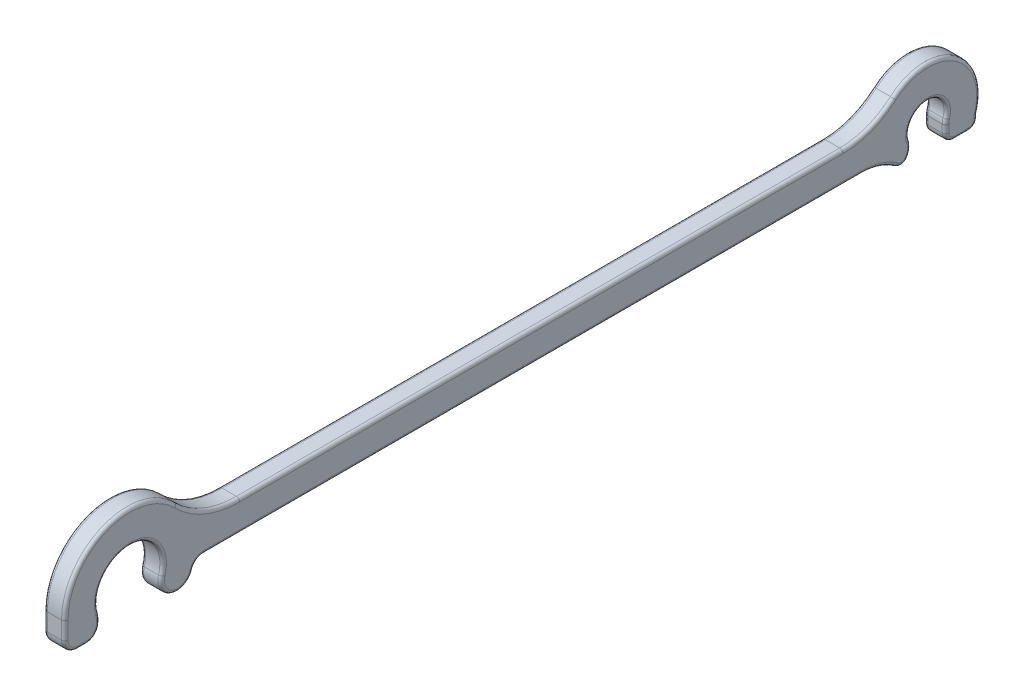
from build123d import *

# Parameters (mm, degrees)
BASE_FLANGE1_DEPTH = 0.95
FILLET1_R          = 0.15


# Sheet-metal steps are written as plain solids
with BuildPart() as part:
    # Sketch1 → Base-Flange1 (new body)
    with BuildSketch(Plane(origin=(0, 0, 0), x_dir=(0, 0, -1), z_dir=(1, 0, 0))):
        with BuildLine():
            Line((4.9989999, 0.9), (32.606977395, 0.9))
            ThreePointArc((32.606977395, 0.9), (33.847044312, 1.127045059), (34.926224905, 1.778723404))
            ThreePointArc((34.926224905, 1.778723404), (37.80078387, 1.987105011), (38.759779045, -0.730769231))
            Line((38.759779045, -0.730769231), (38.759779045, -0.85))
            ThreePointArc((38.759779045, -0.85), (38.642621757, -1.132842712), (38.359779045, -1.25))
            Line((38.359779045, -1.25), (37.69616461, -1.25))
            ThreePointArc((37.69616461, -1.25), (37.413321897, -1.132842712), (37.29616461, -0.85))
            Line((37.29616461, -0.85), (37.29616461, -0.5))
            ThreePointArc((37.29616461, -0.5), (37.305316843, -0.383189954), (37.332550174, -0.269230769))
            ThreePointArc((37.332550174, -0.269230769), (36.5, 0.875), (35.667449826, -0.269230769))
            ThreePointArc((35.667449826, -0.269230769), (35.697994411, -0.593420295), (35.588264267, -0.9))
            ThreePointArc((35.588264267, -0.9), (35.344065569, -1.067822922), (35.054280366, -1.006))
            ThreePointArc((35.054280366, -1.006), (34.298753938, -0.629551565), (33.464637639, -0.5))
            Line((33.464637639, -0.5), (3.365728004, -0.5))
            ThreePointArc((3.365728004, -0.5), (3.058268658, -0.601695186), (2.872087897, -0.866666667))
            ThreePointArc((2.872087897, -0.866666667), (1.937399256, -1.368021974), (1.436043949, -0.433333333))
            ThreePointArc((1.436043949, -0.433333333), (0, 1.5), (-1.436043949, -0.433333333))
            ThreePointArc((-1.436043949, -0.433333333), (-1.412103498, -0.540493107), (-1.404065923, -0.65))
            Line((-1.404065923, -0.65), (-1.404065923, -0.8))
            ThreePointArc((-1.404065923, -0.8), (-1.579801854, -1.224264069), (-2.004065923, -1.4))
            Line((-2.004065923, -1.4), (-2.4, -1.4))
            ThreePointArc((-2.4, -1.4), (-2.824264069, -1.224264069), (-3, -0.8))
            Line((-3, -0.8), (-3, 0))
            ThreePointArc((-3, 0), (-1.134176885, 2.777344558), (2.142428529, 2.1))
            ThreePointArc((2.142428529, 2.1), (3.449806561, 1.212182217), (4.9989999, 0.9))
        make_face()
    extrude(amount=-BASE_FLANGE1_DEPTH)

    # Fillet1
    fillet1_edges = [part.edges().sort_by_distance(p)[0] for p in [
        (-0.95, 1.987105011, -37.80078387),
        (-0.95, 1.127045059, -33.847044312),
        (-0.95, -0.790384615, -38.759779045),
        (-0.95, -1.132842712, -38.642621757),
        (-0.95, -1.25, -38.027971827),
        (-0.95, -1.132842712, -37.413321897),
        (-0.95, -0.675, -37.29616461),
        (-0.95, -0.383189954, -37.305316843),
        (-0.95, 0.875, -36.5),
        (-0.95, -0.593420295, -35.697994411),
        (-0.95, -1.067822922, -35.344065569),
        (-0.95, -0.629551565, -34.298753938),
        (-0.95, -0.5, -18.415182822),
        (-0.95, -0.601695186, -3.058268658),
        (-0.95, -1.368021974, -1.937399256),
        (-0.95, 1.5, 0),
        (-0.95, -0.540493107, 1.412103498),
        (-0.95, -0.725, 1.404065923),
        (-0.95, -1.224264069, 1.579801854),
        (-0.95, -1.4, 2.202032961),
        (-0.95, -1.224264069, 2.824264069),
        (-0.95, -0.4, 3),
        (-0.95, 2.777344558, 1.134176885),
        (-0.95, 1.212182217, -3.449806561),
        (0, 1.987105011, -37.80078387),
        (0, 1.127045059, -33.847044312),
        (0, -0.790384615, -38.759779045),
        (0, -1.132842712, -38.642621757),
        (0, -1.25, -38.027971827),
        (0, -1.132842712, -37.413321897),
        (0, -0.675, -37.29616461),
        (0, -0.383189954, -37.305316843),
        (0, 0.875, -36.5),
        (0, -0.593420295, -35.697994411),
        (0, -1.067822922, -35.344065569),
        (0, -0.629551565, -34.298753938),
        (0, -0.5, -18.415182822),
        (0, -0.601695186, -3.058268658),
        (0, -1.368021974, -1.937399256),
        (0, 1.5, 0),
        (0, -0.540493107, 1.412103498),
        (0, -0.725, 1.404065923),
        (0, -1.224264069, 1.579801854),
        (0, -1.4, 2.202032961),
        (0, -1.224264069, 2.824264069),
        (0, -0.4, 3),
        (0, 2.777344558, 1.134176885),
        (0, 1.212182217, -3.449806561),
        (-0.95, 0.9, -18.802988648),
        (0, 0.9, -18.802988648),
    ]]
    fillet(fillet1_edges, radius=FILLET1_R)


solid = part.part
